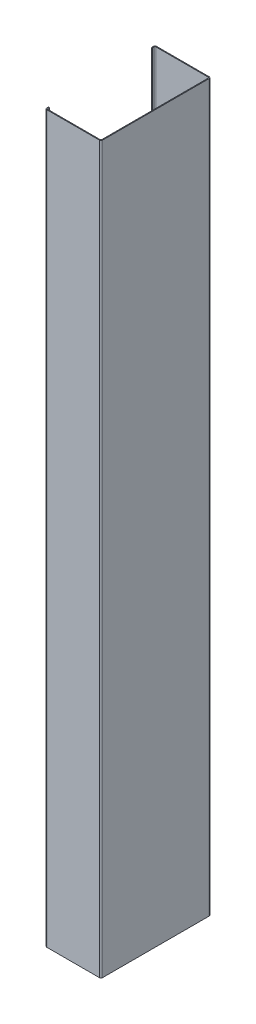
from build123d import *

# Parameters (mm, degrees)
MOVE_BODY_2_DEPTH    = 3000
SKETCH_6_OUTSIDE_W   = 652.406
SKETCH_6_OUTSIDE_H   = 3602.406
SKETCH_6_OUTSIDE_W_2 = 50
SKETCH_6_OUTSIDE_H_2 = 650.75
CUT_EXTRUDE_1_DEPTH  = 3003.033019472


# Read off the part's stored shape, not the designer's step: Тело-Переместить/Копировать2
with BuildPart() as part:
    # Move Body 2 outline → Move Body 2 (new body)
    with BuildSketch(Plane(origin=(0, 0, 0), x_dir=(1, 0, 0), z_dir=(0, 1, 0))):
        with BuildLine():
            Line((-50, 47.75), (-50, 46.25))
            Line((-50, 46.25), (-49.25, 46.25))
            Line((-49.25, 46.25), (-49.25, 47.75))
            ThreePointArc((-49.25, 47.75), (-49.030330086, 48.280330086), (-48.5, 48.5))
            Line((-48.5, 48.5), (-1.5, 48.5))
            ThreePointArc((-1.5, 48.5), (-0.969669914, 48.280330086), (-0.75, 47.75))
            Line((-0.75, 47.75), (-0.75, -47.75))
            ThreePointArc((-0.75, -47.75), (-0.969669914, -48.280330086), (-1.5, -48.5))
            Line((-1.5, -48.5), (-48.5, -48.5))
            ThreePointArc((-48.5, -48.5), (-49.030330086, -48.280330086), (-49.25, -47.75))
            Line((-49.25, -47.75), (-49.25, -46.25))
            Line((-49.25, -46.25), (-50, -46.25))
            Line((-50, -46.25), (-50, -47.75))
            ThreePointArc((-50, -47.75), (-49.560660172, -48.810660172), (-48.5, -49.25))
            Line((-48.5, -49.25), (-1.5, -49.25))
            ThreePointArc((-1.5, -49.25), (-0.439339828, -48.810660172), (0, -47.75))
            Line((0, -47.75), (0, 47.75))
            ThreePointArc((0, 47.75), (-0.439339828, 48.810660172), (-1.5, 49.25))
            Line((-1.5, 49.25), (-48.5, 49.25))
            ThreePointArc((-48.5, 49.25), (-49.560660172, 48.810660172), (-50, 47.75))
        make_face()
    extrude(amount=MOVE_BODY_2_DEPTH)

    # Эскиз6 outside → Вырез-Вытянуть1 (cut, through all)
    with BuildSketch(Plane(origin=(0, 0, -49.25), x_dir=(-1, 0, 0), z_dir=(0, 0, -1))):
        with Locations((25, 1500)):
            Rectangle(SKETCH_6_OUTSIDE_W, SKETCH_6_OUTSIDE_H)
        with Locations((25, 325.375)):
            Rectangle(SKETCH_6_OUTSIDE_W_2, SKETCH_6_OUTSIDE_H_2, mode=Mode.SUBTRACT)
    extrude(amount=-CUT_EXTRUDE_1_DEPTH, mode=Mode.SUBTRACT)


solid = part.part
